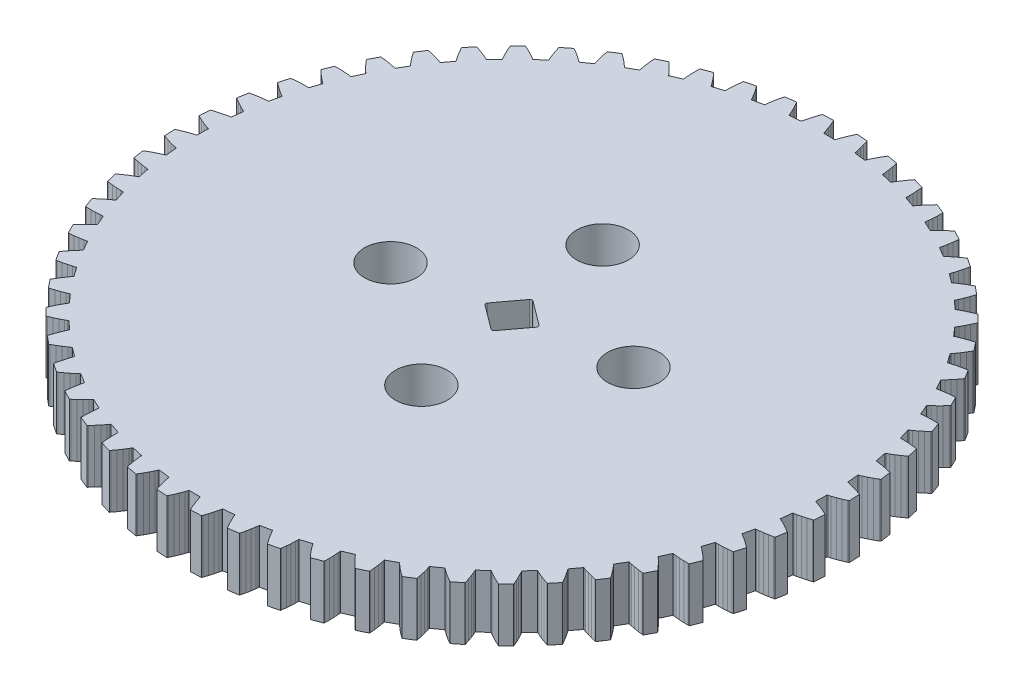
from build123d import *

# Parameters (mm, degrees)
BOSS_EXTRUDE1_DEPTH = 5
SKETCH4_R           = 2.425
CUT_EXTRUDE1_DEPTH  = 88.116042167


with BuildPart() as part:
    # Sketch2 → Boss-Extrude1 (new body)
    with BuildSketch(Plane(origin=(0, 0, 0), x_dir=(1, 0, 0), z_dir=(0, 1, 0))):
        Polygon((1.58772, 28.58677), (1.49181, 28.60637), (1.2998, 28.64919), (0.91518, 28.74841), (0.53003, 28.86446), (0.14462, 28.99618), (0.04826, 29.03145), (0.00853, 30.02926), (0.10179, 30.07209), (0.4755, 30.23403), (0.85021, 30.38032), (1.22572, 30.50982), (1.41372, 30.56776), (1.50777, 30.59492), (1.52099, 31.64732), (1.42765, 31.67683), (1.24117, 31.73948), (0.86903, 31.87837), (0.49812, 32.03404), (0.12859, 32.20532), (0.03645, 32.25047), (0.10124, 33.24697), (0.19845, 33.27981), (0.58705, 33.4018), (0.975, 33.50813), (1.36199, 33.59766), (1.55501, 33.63564), (1.65139, 33.65282), (1.77454, 34.69807), (1.6848, 34.73717), (1.50589, 34.81898), (1.15031, 34.996), (0.7977, 35.18959), (0.4481, 35.39856), (0.36118, 35.4531), (0.52978, 36.43736), (0.62989, 36.45986), (1.02911, 36.54057), (1.42605, 36.60576), (1.82027, 36.65435), (2.01621, 36.67195), (2.11385, 36.67896), (2.3456, 37.7056), (2.26043, 37.75388), (2.09105, 37.85393), (1.75592, 38.06716), (1.42548, 38.29654), (1.09964, 38.54091), (1.0189, 38.60423), (1.28945, 39.56549), (1.39137, 39.5774), (1.79684, 39.61593), (2.19842, 39.63928), (2.59556, 39.64639), (2.79227, 39.64341), (2.89011, 39.64017), (3.22789, 40.63697), (3.14824, 40.69388), (2.99025, 40.8111), (2.67924, 41.05818), (2.37459, 41.32085), (2.07608, 41.59794), (2.00239, 41.66936), (2.37195, 42.59706), (2.47456, 42.59826), (2.88183, 42.59419), (3.28364, 42.57544), (3.67936, 42.541), (3.87467, 42.51747), (3.97164, 42.50403), (4.41177, 43.46006), (4.3385, 43.52498), (4.19363, 43.65807), (3.91015, 43.93631), (3.63463, 44.22938), (3.36671, 44.53616), (3.3009, 44.61489), (3.7654, 45.49888), (3.86757, 45.48934), (4.27219, 45.44273), (4.66984, 45.38207), (5.05979, 45.30646), (5.25157, 45.26265), (5.3466, 45.23914), (5.88425, 46.14393), (5.81818, 46.21616), (5.688, 46.36366), (5.43517, 46.67001), (5.19178, 46.99027), (4.9574, 47.32337), (4.90018, 47.40855), (5.45454, 48.23915), (5.55515, 48.21898), (5.95268, 48.13033), (6.34181, 48.02844), (6.72172, 47.91248), (6.90788, 47.84886), (6.99993, 47.81555), (7.62921, 48.65918), (7.57104, 48.73792), (7.457, 48.89822), (7.23757, 49.22932), (7.029, 49.57327), (6.83072, 49.92905), (6.78271, 50.01974), (7.42086, 50.78784), (7.51881, 50.75727), (7.9049, 50.62755), (8.28125, 50.48554), (8.64696, 50.33051), (8.82544, 50.24777), (8.91351, 50.20502), (9.62752, 50.97826), (9.57791, 51.06264), (9.48125, 51.23399), (9.29763, 51.58621), (9.12615, 51.95008), (8.96615, 52.32463), (8.92788, 52.41984), (9.64282, 53.11703), (9.73704, 53.07639), (10.10745, 52.90702), (10.4669, 52.72646), (10.8144, 52.53404), (10.98326, 52.43311), (11.06637, 52.38139), (11.8573, 53.07575), (11.81678, 53.16486), (11.73856, 53.34537), (11.59276, 53.71485), (11.46026, 54.09466), (11.34028, 54.48388), (11.31218, 54.58257), (12.09607, 55.20121), (12.18553, 55.15094), (12.53621, 54.94378), (12.87481, 54.72663), (13.2003, 54.49895), (13.35768, 54.38092), (13.43493, 54.32079), (14.29411, 54.92867), (14.26312, 55.02153), (14.2042, 55.20923), (14.09782, 55.59193), (14.00575, 55.9835), (13.92711, 56.38313), (13.90948, 56.48422), (14.75375, 57.01753), (14.83746, 56.95819), (15.16456, 56.71551), (15.47861, 56.46415), (15.77851, 56.2037), (15.92269, 56.06986), (15.99324, 56.00199), (16.91125, 56.51673), (16.89014, 56.61232), (16.85116, 56.80515), (16.78537, 57.19687), (16.73473, 57.59592), (16.6983, 58.00159), (16.69133, 58.10396), (17.58672, 58.5461), (17.66377, 58.47833), (17.96371, 58.20279), (18.24977, 57.91999), (18.5208, 57.62961), (18.6502, 57.48143), (18.71327, 57.40656), (19.68006, 57.82253), (19.66905, 57.9198), (19.65044, 58.11564), (19.62596, 58.5121), (19.61731, 58.91426), (19.62348, 59.32151), (19.62725, 59.42405), (20.56395, 59.77018), (20.63349, 59.69472), (20.90299, 59.38934), (21.15792, 59.07818), (21.39711, 58.76106), (21.51032, 58.60017), (21.56521, 58.51912), (22.57018, 58.83175), (22.56941, 58.92964), (22.57137, 59.12635), (22.58846, 59.5232), (22.6219, 59.92406), (22.6706, 60.32843), (22.68507, 60.43002), (23.65282, 60.67634), (23.7141, 60.59402), (23.9502, 60.26214), (24.1712, 59.92604), (24.37594, 59.58566), (24.47171, 59.41382), (24.51783, 59.32747), (25.54997, 59.53334), (25.55943, 59.63077), (25.58195, 59.82621), (25.64043, 60.21909), (25.71558, 60.61426), (25.80629, 61.01133), (25.8313, 61.11085), (26.81949, 61.25466), (26.87183, 61.16639), (27.07194, 60.81165), (27.25661, 60.45429), (27.42464, 60.09437), (27.50192, 59.91346), (27.53876, 59.82276), (28.58677, 59.91962), (28.60637, 60.01553), (28.64919, 60.20754), (28.74841, 60.59216), (28.86446, 60.97731), (28.99618, 61.36271), (29.03145, 61.45908), (30.02926, 61.4988), (30.07209, 61.40555), (30.23403, 61.03183), (30.38032, 60.65713), (30.50982, 60.28162), (30.56776, 60.09362), (30.59492, 59.99957), (31.64732, 59.98634), (31.67683, 60.07968), (31.73948, 60.26617), (31.87837, 60.6383), (32.03404, 61.00921), (32.20532, 61.37874), (32.25047, 61.47089), (33.24697, 61.4061), (33.27981, 61.30888), (33.4018, 60.92029), (33.50813, 60.53234), (33.59766, 60.14535), (33.63564, 59.95232), (33.65282, 59.85595), (34.69807, 59.73279), (34.73717, 59.82253), (34.81898, 60.00145), (34.996, 60.35703), (35.18959, 60.70964), (35.39856, 61.05924), (35.4531, 61.14616), (36.43736, 60.97756), (36.45986, 60.87744), (36.54057, 60.47822), (36.60576, 60.08129), (36.65435, 59.68706), (36.67195, 59.49112), (36.67896, 59.39348), (37.7056, 59.16174), (37.75388, 59.2469), (37.85393, 59.41628), (38.06716, 59.75141), (38.29654, 60.08185), (38.54091, 60.4077), (38.60423, 60.48844), (39.56549, 60.21788), (39.5774, 60.11596), (39.61593, 59.71049), (39.63928, 59.30892), (39.64639, 58.91177), (39.64341, 58.71507), (39.64017, 58.61723), (40.63697, 58.27944), (40.69388, 58.35909), (40.8111, 58.51709), (41.05818, 58.82809), (41.32085, 59.13275), (41.59794, 59.43126), (41.66936, 59.50494), (42.59706, 59.13539), (42.59826, 59.03278), (42.59419, 58.62551), (42.57544, 58.22369), (42.541, 57.82798), (42.51747, 57.63266), (42.50403, 57.5357), (43.46006, 57.09557), (43.52498, 57.16883), (43.65807, 57.31371), (43.93631, 57.59718), (44.22938, 57.87271), (44.53616, 58.14063), (44.61489, 58.20644), (45.49888, 57.74194), (45.48934, 57.63977), (45.44273, 57.23515), (45.38207, 56.8375), (45.30646, 56.44755), (45.26265, 56.25576), (45.23914, 56.16073), (46.14393, 55.62308), (46.21616, 55.68916), (46.36366, 55.81933), (46.67001, 56.07217), (46.99027, 56.31555), (47.32337, 56.54993), (47.40855, 56.60716), (48.23915, 56.0528), (48.21898, 55.95219), (48.13033, 55.55466), (48.02844, 55.16552), (47.91248, 54.78561), (47.84886, 54.59946), (47.81555, 54.50741), (48.65918, 53.87813), (48.73792, 53.93629), (48.89822, 54.05033), (49.22932, 54.26976), (49.57327, 54.47834), (49.92905, 54.67661), (50.01974, 54.72462), (50.78784, 54.08648), (50.75727, 53.98852), (50.62755, 53.60244), (50.48554, 53.22609), (50.33051, 52.86038), (50.24777, 52.6819), (50.20502, 52.59383), (50.97826, 51.87981), (51.06264, 51.92943), (51.23399, 52.02609), (51.58621, 52.20971), (51.95008, 52.38119), (52.32463, 52.54119), (52.41984, 52.57945), (53.11703, 51.86452), (53.07639, 51.7703), (52.90702, 51.39989), (52.72646, 51.04044), (52.53404, 50.69294), (52.43311, 50.52408), (52.38139, 50.44097), (53.07575, 49.65004), (53.16486, 49.69056), (53.34537, 49.76878), (53.71485, 49.91458), (54.09466, 50.04708), (54.48388, 50.16705), (54.58257, 50.19516), (55.20121, 49.41126), (55.15094, 49.3218), (54.94378, 48.97113), (54.72663, 48.63252), (54.49895, 48.30704), (54.38092, 48.14966), (54.32079, 48.07241), (54.92867, 47.21323), (55.02153, 47.24421), (55.20923, 47.30314), (55.59193, 47.40951), (55.9835, 47.50159), (56.38313, 47.58022), (56.48422, 47.59786), (57.01753, 46.75359), (56.95819, 46.66988), (56.71551, 46.34277), (56.46415, 46.02872), (56.2037, 45.72882), (56.06986, 45.58464), (56.00199, 45.5141), (56.51673, 44.59608), (56.61232, 44.61719), (56.80515, 44.65618), (57.19687, 44.72197), (57.59592, 44.77261), (58.00159, 44.80904), (58.10396, 44.81601), (58.5461, 43.92062), (58.47833, 43.84357), (58.20279, 43.54362), (57.91999, 43.25757), (57.62961, 42.98654), (57.48143, 42.85713), (57.40656, 42.79407), (57.82253, 41.82728), (57.9198, 41.83828), (58.11564, 41.8569), (58.5121, 41.88138), (58.91426, 41.89003), (59.32151, 41.88386), (59.42405, 41.88009), (59.77018, 40.94339), (59.69472, 40.87384), (59.38934, 40.60434), (59.07818, 40.34942), (58.76106, 40.11022), (58.60017, 39.99702), (58.51912, 39.94213), (58.83175, 38.93715), (58.92964, 38.93793), (59.12635, 38.93597), (59.5232, 38.91887), (59.92406, 38.88544), (60.32843, 38.83673), (60.43002, 38.82226), (60.67634, 37.85452), (60.59402, 37.79324), (60.26214, 37.55714), (59.92604, 37.33613), (59.58566, 37.1314), (59.41382, 37.03563), (59.32747, 36.98951), (59.53334, 35.95736), (59.63077, 35.9479), (59.82621, 35.92539), (60.21909, 35.86691), (60.61426, 35.79176), (61.01133, 35.70105), (61.11085, 35.67604), (61.25466, 34.68785), (61.16639, 34.63551), (60.81165, 34.43539), (60.45429, 34.25073), (60.09437, 34.08269), (59.91346, 34.00541), (59.82276, 33.96857), (59.91962, 32.92056), (60.01553, 32.90097), (60.20754, 32.85815), (60.59216, 32.75892), (60.97731, 32.64288), (61.36271, 32.51116), (61.45908, 32.47589), (61.4988, 31.47807), (61.40555, 31.43525), (61.03183, 31.27331), (60.65713, 31.12701), (60.28162, 30.99752), (60.09362, 30.93957), (59.99957, 30.91241), (59.98634, 29.86002), (60.07968, 29.83051), (60.26617, 29.76785), (60.6383, 29.62897), (61.00921, 29.4733), (61.37874, 29.30202), (61.47089, 29.25686), (61.4061, 28.26036), (61.30888, 28.22752), (60.92029, 28.10553), (60.53234, 27.9992), (60.14535, 27.90967), (59.95232, 27.87169), (59.85595, 27.85452), (59.73279, 26.80927), (59.82253, 26.77016), (60.00145, 26.68836), (60.35703, 26.51133), (60.70964, 26.31775), (61.05924, 26.10878), (61.14616, 26.05424), (60.97756, 25.06997), (60.87744, 25.04747), (60.47822, 24.96677), (60.08129, 24.90157), (59.68706, 24.85298), (59.49112, 24.83539), (59.39348, 24.82838), (59.16174, 23.80173), (59.2469, 23.75346), (59.41628, 23.6534), (59.75141, 23.44018), (60.08185, 23.21079), (60.4077, 22.96643), (60.48844, 22.9031), (60.21788, 21.94185), (60.11596, 21.92994), (59.71049, 21.89141), (59.30892, 21.86806), (58.91177, 21.86094), (58.71507, 21.86393), (58.61723, 21.86716), (58.27944, 20.87036), (58.35909, 20.81345), (58.51709, 20.69624), (58.82809, 20.44915), (59.13275, 20.18649), (59.43126, 19.9094), (59.50494, 19.83798), (59.13539, 18.91027), (59.03278, 18.90908), (58.62551, 18.91314), (58.22369, 18.9319), (57.82798, 18.96634), (57.63266, 18.98987), (57.5357, 19.00331), (57.09557, 18.04728), (57.16883, 17.98235), (57.31371, 17.84927), (57.59718, 17.57103), (57.87271, 17.27795), (58.14063, 16.97118), (58.20644, 16.89245), (57.74194, 16.00845), (57.63977, 16.01799), (57.23515, 16.06461), (56.8375, 16.12526), (56.44755, 16.20087), (56.25576, 16.24469), (56.16073, 16.2682), (55.62308, 15.36341), (55.68916, 15.29118), (55.81933, 15.14368), (56.07217, 14.83733), (56.31555, 14.51706), (56.54993, 14.18396), (56.60716, 14.09879), (56.0528, 13.26819), (55.95219, 13.28836), (55.55466, 13.37701), (55.16552, 13.4789), (54.78561, 13.59485), (54.59946, 13.65848), (54.50741, 13.69179), (53.87813, 12.84816), (53.93629, 12.76942), (54.05033, 12.60912), (54.26976, 12.27802), (54.47834, 11.93406), (54.67661, 11.57829), (54.72462, 11.4876), (54.08648, 10.7195), (53.98852, 10.75007), (53.60244, 10.87979), (53.22609, 11.0218), (52.86038, 11.17683), (52.6819, 11.25956), (52.59383, 11.30231), (51.87981, 10.52908), (51.92943, 10.44469), (52.02609, 10.27335), (52.20971, 9.92113), (52.38119, 9.55726), (52.54119, 9.18271), (52.57945, 9.08749), (51.86452, 8.3903), (51.7703, 8.43095), (51.39989, 8.60031), (51.04044, 8.78088), (50.69294, 8.97329), (50.52408, 9.07423), (50.44097, 9.12595), (49.65004, 8.43159), (49.69056, 8.34248), (49.76878, 8.16197), (49.91458, 7.79248), (50.04708, 7.41268), (50.16705, 7.02346), (50.19516, 6.92477), (49.41126, 6.30613), (49.3218, 6.3564), (48.97113, 6.56355), (48.63252, 6.78071), (48.30704, 7.00839), (48.14966, 7.12642), (48.07241, 7.18655), (47.21323, 6.57866), (47.24421, 6.4858), (47.30314, 6.29811), (47.40951, 5.91541), (47.50159, 5.52383), (47.58022, 5.1242), (47.59786, 5.02311), (46.75359, 4.4898), (46.66988, 4.54915), (46.34277, 4.79183), (46.02872, 5.04318), (45.72882, 5.30364), (45.58464, 5.43748), (45.5141, 5.50535), (44.59608, 4.9906), (44.61719, 4.89501), (44.65618, 4.70219), (44.72197, 4.31046), (44.77261, 3.91141), (44.80904, 3.50575), (44.81601, 3.40337), (43.92062, 2.96123), (43.84357, 3.029), (43.54362, 3.30454), (43.25757, 3.58735), (42.98654, 3.87773), (42.85713, 4.0259), (42.79407, 4.10078), (41.82728, 3.68481), (41.83828, 3.58754), (41.8569, 3.39169), (41.88138, 2.99524), (41.89003, 2.59308), (41.88386, 2.18583), (41.88009, 2.08328), (40.94339, 1.73716), (40.87384, 1.81262), (40.60434, 2.118), (40.34942, 2.42916), (40.11022, 2.74627), (39.99702, 2.90716), (39.94213, 2.98822), (38.93715, 2.67559), (38.93793, 2.5777), (38.93597, 2.38098), (38.91887, 1.98414), (38.88544, 1.58328), (38.83673, 1.17891), (38.82226, 1.07732), (37.85452, 0.831), (37.79324, 0.91331), (37.55714, 1.24519), (37.33613, 1.58129), (37.1314, 1.92167), (37.03563, 2.09352), (36.98951, 2.17987), (35.95736, 1.974), (35.9479, 1.87656), (35.92539, 1.68113), (35.86691, 1.28825), (35.79176, 0.89307), (35.70105, 0.49601), (35.67604, 0.39649), (34.68785, 0.25268), (34.63551, 0.34094), (34.43539, 0.69569), (34.25073, 1.05305), (34.08269, 1.41296), (34.00541, 1.59388), (33.96857, 1.68457), (32.92056, 1.58772), (32.90097, 1.49181), (32.85815, 1.2998), (32.75892, 0.91518), (32.64288, 0.53003), (32.51116, 0.14462), (32.47589, 0.04826), (31.47807, 0.00853), (31.43525, 0.10179), (31.27331, 0.4755), (31.12701, 0.85021), (30.99752, 1.22572), (30.93957, 1.41372), (30.91241, 1.50777), (29.86002, 1.52099), (29.83051, 1.42765), (29.76785, 1.24117), (29.62897, 0.86903), (29.4733, 0.49812), (29.30202, 0.12859), (29.25686, 0.03645), (28.26036, 0.10124), (28.22752, 0.19845), (28.10553, 0.58705), (27.9992, 0.975), (27.90967, 1.36199), (27.87169, 1.55501), (27.85452, 1.65139), (26.80927, 1.77454), (26.77016, 1.6848), (26.68836, 1.50589), (26.51133, 1.15031), (26.31775, 0.7977), (26.10878, 0.4481), (26.05424, 0.36118), (25.06997, 0.52978), (25.04747, 0.62989), (24.96677, 1.02911), (24.90157, 1.42605), (24.85298, 1.82027), (24.83539, 2.01621), (24.82838, 2.11385), (23.80173, 2.3456), (23.75346, 2.26043), (23.6534, 2.09105), (23.44018, 1.75592), (23.21079, 1.42548), (22.96643, 1.09964), (22.9031, 1.0189), (21.94185, 1.28945), (21.92994, 1.39137), (21.89141, 1.79684), (21.86806, 2.19842), (21.86094, 2.59556), (21.86393, 2.79227), (21.86716, 2.89011), (20.87036, 3.22789), (20.81345, 3.14824), (20.69624, 2.99025), (20.44915, 2.67924), (20.18649, 2.37459), (19.9094, 2.07608), (19.83798, 2.00239), (18.91027, 2.37195), (18.90908, 2.47456), (18.91314, 2.88183), (18.9319, 3.28364), (18.96634, 3.67936), (18.98987, 3.87467), (19.00331, 3.97164), (18.04728, 4.41177), (17.98235, 4.3385), (17.84927, 4.19363), (17.57103, 3.91015), (17.27795, 3.63463), (16.97118, 3.36671), (16.89245, 3.3009), (16.00845, 3.7654), (16.01799, 3.86757), (16.06461, 4.27219), (16.12526, 4.66984), (16.20087, 5.05979), (16.24469, 5.25157), (16.2682, 5.3466), (15.36341, 5.88425), (15.29118, 5.81818), (15.14368, 5.688), (14.83733, 5.43517), (14.51706, 5.19178), (14.18396, 4.9574), (14.09879, 4.90018), (13.26819, 5.45454), (13.28836, 5.55515), (13.37701, 5.95268), (13.4789, 6.34181), (13.59485, 6.72172), (13.65848, 6.90788), (13.69179, 6.99993), (12.84816, 7.62921), (12.76942, 7.57104), (12.60912, 7.457), (12.27802, 7.23757), (11.93406, 7.029), (11.57829, 6.83072), (11.4876, 6.78271), (10.7195, 7.42086), (10.75007, 7.51881), (10.87979, 7.9049), (11.0218, 8.28125), (11.17683, 8.64696), (11.25956, 8.82544), (11.30231, 8.91351), (10.52908, 9.62752), (10.44469, 9.57791), (10.27335, 9.48125), (9.92113, 9.29763), (9.55726, 9.12615), (9.18271, 8.96615), (9.08749, 8.92788), (8.3903, 9.64282), (8.43095, 9.73704), (8.60031, 10.10745), (8.78088, 10.4669), (8.97329, 10.8144), (9.07423, 10.98326), (9.12595, 11.06637), (8.43159, 11.8573), (8.34248, 11.81678), (8.16197, 11.73856), (7.79248, 11.59276), (7.41268, 11.46026), (7.02346, 11.34028), (6.92477, 11.31218), (6.30613, 12.09607), (6.3564, 12.18553), (6.56355, 12.53621), (6.78071, 12.87481), (7.00839, 13.2003), (7.12642, 13.35768), (7.18655, 13.43493), (6.57866, 14.29411), (6.4858, 14.26312), (6.29811, 14.2042), (5.91541, 14.09782), (5.52383, 14.00575), (5.1242, 13.92711), (5.02311, 13.90948), (4.4898, 14.75375), (4.54915, 14.83746), (4.79183, 15.16456), (5.04318, 15.47861), (5.30364, 15.77851), (5.43748, 15.92269), (5.50535, 15.99324), (4.9906, 16.91125), (4.89501, 16.89014), (4.70219, 16.85116), (4.31046, 16.78537), (3.91141, 16.73473), (3.50575, 16.6983), (3.40337, 16.69133), (2.96123, 17.58672), (3.029, 17.66377), (3.30454, 17.96371), (3.58735, 18.24977), (3.87773, 18.5208), (4.0259, 18.6502), (4.10078, 18.71327), (3.68481, 19.68006), (3.58754, 19.66905), (3.39169, 19.65044), (2.99524, 19.62596), (2.59308, 19.61731), (2.18583, 19.62348), (2.08328, 19.62725), (1.73716, 20.56395), (1.81262, 20.63349), (2.118, 20.90299), (2.42916, 21.15792), (2.74627, 21.39711), (2.90716, 21.51032), (2.98822, 21.56521), (2.67559, 22.57018), (2.5777, 22.56941), (2.38098, 22.57137), (1.98414, 22.58846), (1.58328, 22.6219), (1.17891, 22.6706), (1.07732, 22.68507), (0.831, 23.65282), (0.91331, 23.7141), (1.24519, 23.9502), (1.58129, 24.1712), (1.92167, 24.37594), (2.09352, 24.47171), (2.17987, 24.51783), (1.974, 25.54997), (1.87656, 25.55943), (1.68113, 25.58195), (1.28825, 25.64043), (0.89307, 25.71558), (0.49601, 25.80629), (0.39649, 25.8313), (0.25268, 26.81949), (0.34094, 26.87183), (0.69569, 27.07194), (1.05305, 27.25661), (1.41296, 27.42464), (1.59388, 27.50192), (1.68457, 27.53876), align=None)
    extrude(amount=BOSS_EXTRUDE1_DEPTH)

    # Sketch4 → Cut-Extrude1 (cut, through all)
    with BuildSketch(Plane.XZ):
        with Locations((20.857908483, -29.313562506)):
            Circle(SKETCH4_R)
        with Locations((29.313562506, -40.649431517)):
            Circle(SKETCH4_R)
        with Locations((40.649431517, -32.193777494)):
            Circle(SKETCH4_R)
        with Locations((32.193777494, -20.857908483)):
            Circle(SKETCH4_R)
        with BuildLine():
            Line((30.919216003, -28.634095882), (28.674828508, -30.308229919))
            ThreePointArc((28.674828508, -30.308229919), (28.596494286, -30.439741162), (28.634096118, -30.588124314))
            Line((28.634096118, -30.588124314), (30.308230155, -32.832511809))
            ThreePointArc((30.308230155, -32.832511809), (30.439741399, -32.910846031), (30.58812455, -32.873244199))
            Line((30.58812455, -32.873244199), (32.832512045, -31.199110162))
            ThreePointArc((32.832512045, -31.199110162), (32.910846267, -31.067598918), (32.873244435, -30.919215766))
            Line((32.873244435, -30.919215766), (31.199110398, -28.674828272))
            ThreePointArc((31.199110398, -28.674828272), (31.067599155, -28.59649405), (30.919216003, -28.634095882))
        make_face()
    extrude(amount=-CUT_EXTRUDE1_DEPTH, mode=Mode.SUBTRACT)


solid = part.part
